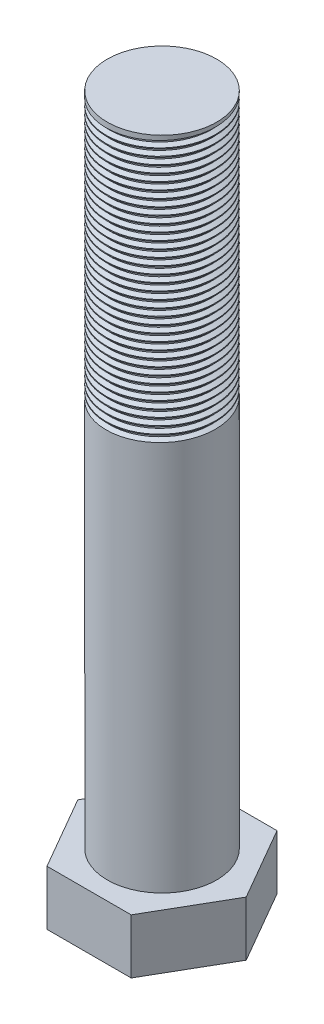
from build123d import *

# Parameters (mm, degrees)
BOSS_EXTRUDE1_DEPTH = 15
SKETCH3_R           = 15
BOSS_EXTRUDE2_DEPTH = 180
THREAD1_PITCH       = 2


with BuildPart() as part:
    # Sketch2 → Boss-Extrude1 (new body)
    with BuildSketch(Plane(origin=(0, 0, 0), x_dir=(1, 0, 0), z_dir=(0, 1, 0))):
        Polygon((23.094010768, 0), (11.547005384, 20), (-11.547005384, 20), (-23.094010768, 0), (-11.547005384, -20), (11.547005384, -20), align=None)
    extrude(amount=BOSS_EXTRUDE1_DEPTH)

    # Sketch3 → Boss-Extrude2 (add)
    with BuildSketch(Plane(origin=(0, 15, 0), x_dir=(1, 0, 0), z_dir=(0, 1, 0))):
        with Locations(Location((0, 0, 0), (0, 0, 90))):
            Circle(SKETCH3_R)
    extrude(amount=BOSS_EXTRUDE2_DEPTH)

    # Thread1: the profile of Thread Profile1 profile screwed along a right-hand helix of 36 turns, 10 arcs to a turn; built about Z, then put on its axis
    thread1_z = Axis((0, 0, 0), (0, 0, 1))
    thread1_corners = [(15.0003, 0, -0.000173205), (15.0003, 0, 1.7501732), (13.91746825, 0, 1.124999997), (13.91746825, 0, 0.624999997)]
    with BuildLine(mode=Mode.PRIVATE) as thread1_profile:
        Line(thread1_corners[0], thread1_corners[1])
        Line(thread1_corners[1], thread1_corners[2])
        Line(thread1_corners[2], thread1_corners[3])
        Line(thread1_corners[3], thread1_corners[0])
    thread1_cap = Face(thread1_profile.wire())
    thread1_turn_angles = [0, 18, 36, 54, 72, 90, 108, 126, 144, 162, 180, 198, 216, 234, 252, 270, 288, 306, 324, 342, 360]
    thread1_turn_weights = [1, 0.9510565162951535, 1, 0.9510565162951535, 1, 0.9510565162951535, 1, 0.9510565162951535, 1, 0.9510565162951535, 1, 0.9510565162951535, 1, 0.9510565162951535, 1, 0.9510565162951535, 1, 0.9510565162951535, 1, 0.9510565162951535, 1]
    thread1_turn_rails = [Edge.make_bspline([Vector(p[0], p[1], 0).rotate(thread1_z, thread1_turn_angles[k]) / thread1_turn_weights[k] + Vector(0, 0, p[2] + THREAD1_PITCH * thread1_turn_angles[k] / 360) for k in range(21)], [0, 0, 0, 1, 1, 2, 2, 3, 3, 4, 4, 5, 5, 6, 6, 7, 7, 8, 8, 9, 9, 10, 10, 10], 2, thread1_turn_weights) for p in thread1_corners]
    thread1_turn_sides = [Face.make_surface_from_curves(thread1_turn_rails[p[0]], thread1_turn_rails[p[1]]) for p in [(0, 1), (1, 2), (2, 3), (3, 0)]]
    thread1 = Plane(origin=(0, 195, 0), x_dir=(-1, 0, 0), z_dir=(0, -1, 0)) * Solid(Shell([*[p.moved(Location((0, 0, THREAD1_PITCH * i))) for i in range(36) for p in thread1_turn_sides], thread1_cap, thread1_cap.rotate(thread1_z, 12960).moved(Location((0, 0, THREAD1_PITCH * 12960 / 360)))]))
    add(thread1, mode=Mode.SUBTRACT)


solid = part.part
